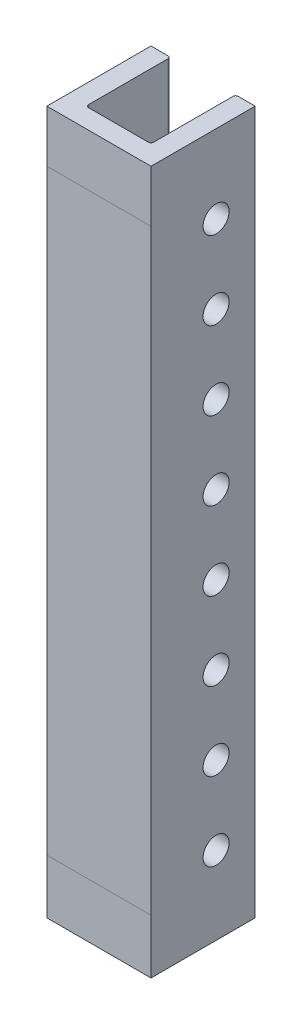
from build123d import *

# Parameters (mm, degrees)
BOSS_EXTRUDE1_DEPTH = 342.9
SKETCH2_R           = 6.35
CUT_EXTRUDE1_DEPTH  = 304.8
FILLET1_R           = 1.27


with BuildPart() as part:
    # Sketch1 → Boss-Extrude1 (new body)
    with BuildSketch(Plane(origin=(0, 0, 0), x_dir=(1, 0, 0), z_dir=(0, 1, 0))):
        Polygon((0, 0), (50.8, 0), (50.8, 50.8), (41.275, 50.8), (41.275, 9.525), (9.525, 9.525), (9.525, 50.8), (0, 50.8), align=None)
    extrude(amount=BOSS_EXTRUDE1_DEPTH)

    # Sketch2 → Cut-Extrude1 (cut)
    with BuildSketch(Plane(origin=(50.8, 0, 0), x_dir=(0, 0, -1), z_dir=(1, 0, 0))):
        with Locations((31.75, 304.8)):
            Circle(SKETCH2_R)
        with Locations((31.75, 190.5)):
            Circle(SKETCH2_R)
        with Locations((31.75, 228.6)):
            Circle(SKETCH2_R)
        with Locations((31.75, 266.7)):
            Circle(SKETCH2_R)
        with Locations((31.75, 76.2)):
            Circle(SKETCH2_R)
        with Locations((31.75, 38.1)):
            Circle(SKETCH2_R)
        with Locations((31.75, 152.4)):
            Circle(SKETCH2_R)
        with Locations((31.75, 114.3)):
            Circle(SKETCH2_R)
    extrude(amount=-CUT_EXTRUDE1_DEPTH, mode=Mode.SUBTRACT)

    # Fillet1
    fillet1_edges = [part.edges().sort_by_distance(p)[0] for p in [
        (41.275, 171.45, -9.525),
        (9.525, 171.45, -50.8),
        (41.275, 171.45, -50.8),
        (9.525, 171.45, -9.525),
    ]]
    fillet(fillet1_edges, radius=FILLET1_R)


solid = part.part
